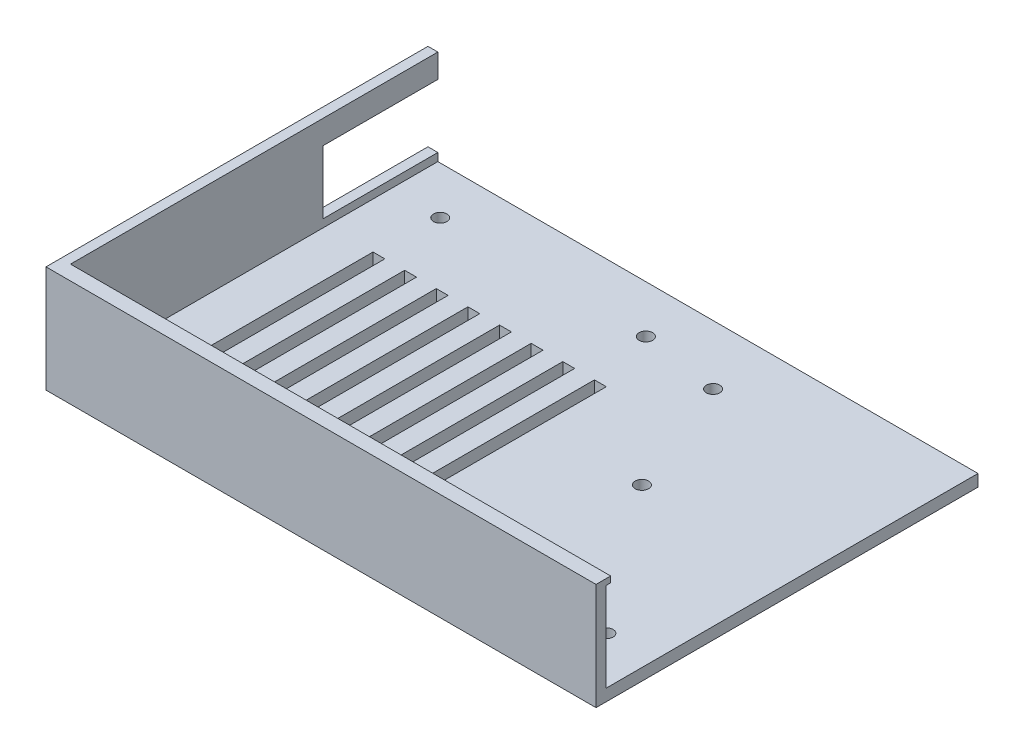
from build123d import *

# Parameters (mm, degrees)
SKETCH1_W                     = 278.2
SKETCH1_H                     = 193.2
SHELL_BLOCK_DEPTH             = 27
SKETCH2_W                     = 273.2
SKETCH2_H                     = 185.8
FRONT_OPENING_DEPTH           = 1.5
SKETCH3_W                     = 273.2
SKETCH3_H                     = 188.2
DISPLAY_POCKET_DEPTH          = 22.5
SKETCH4_W                     = 3
SKETCH4_H                     = 56
VENT_SLOTS_DEPTH              = 4
SKETCH5_W                     = 58
SKETCH5_H                     = 16
CABLE_EXIT_X_SHORT_SIDE_DEPTH = 140.1
SKETCH6_R                     = 1.7
BOLT_HOLES_DEPTH              = 4
KEEP_ONE_HALF_X_DEPTH         = 172.491603293
KEEP_ONE_HALF_X_DEPTH_BACK    = 172.491603293
SKETCH7_W                     = 200
SKETCH7_H                     = 400
KEEP_ONE_QUARTER_Z_DEPTH      = 172.491603293
KEEP_ONE_QUARTER_Z_DEPTH_BACK = 172.491603293
SKETCH8_W                     = 400
SKETCH8_H                     = 200


with BuildPart() as part:
    # Sketch1 → Shell Block (new body)
    with BuildSketch(Plane(origin=(0, 0, 0), x_dir=(1, 0, 0), z_dir=(0, 1, 0))):
        Rectangle(SKETCH1_W, SKETCH1_H)
    extrude(amount=SHELL_BLOCK_DEPTH)

    # Sketch2 → Front Opening (cut)
    with BuildSketch(Plane(origin=(0, 27, 0), x_dir=(1, 0, 0), z_dir=(0, 1, 0))):
        Rectangle(SKETCH2_W, SKETCH2_H)
    extrude(amount=-FRONT_OPENING_DEPTH, mode=Mode.SUBTRACT)

    # Sketch3 → Display Pocket (cut)
    with BuildSketch(Plane(origin=(0, 25.5, 0), x_dir=(1, 0, 0), z_dir=(0, 1, 0))):
        Rectangle(SKETCH3_W, SKETCH3_H)
    extrude(amount=-DISPLAY_POCKET_DEPTH, mode=Mode.SUBTRACT)

    # Sketch4 → Vent Slots (cut)
    with BuildSketch(Plane(origin=(0, 3, 0), x_dir=(1, 0, 0), z_dir=(0, 1, 0))):
        with Locations((-67.5, 56)):
            Rectangle(SKETCH4_W, SKETCH4_H)
        with Locations((-67.5, -56)):
            Rectangle(SKETCH4_W, SKETCH4_H)
        with Locations((-75.5, 56)):
            Rectangle(SKETCH4_W, SKETCH4_H)
        with Locations((-75.5, -56)):
            Rectangle(SKETCH4_W, SKETCH4_H)
        with Locations((-83.5, 56)):
            Rectangle(SKETCH4_W, SKETCH4_H)
        with Locations((-83.5, -56)):
            Rectangle(SKETCH4_W, SKETCH4_H)
        with Locations((-91.5, 56)):
            Rectangle(SKETCH4_W, SKETCH4_H)
        with Locations((-91.5, -56)):
            Rectangle(SKETCH4_W, SKETCH4_H)
        with Locations((-99.5, 56)):
            Rectangle(SKETCH4_W, SKETCH4_H)
        with Locations((-99.5, -56)):
            Rectangle(SKETCH4_W, SKETCH4_H)
        with Locations((-107.5, 56)):
            Rectangle(SKETCH4_W, SKETCH4_H)
        with Locations((-107.5, -56)):
            Rectangle(SKETCH4_W, SKETCH4_H)
        with Locations((-115.5, 56)):
            Rectangle(SKETCH4_W, SKETCH4_H)
        with Locations((-115.5, -56)):
            Rectangle(SKETCH4_W, SKETCH4_H)
        with Locations((-123.5, 56)):
            Rectangle(SKETCH4_W, SKETCH4_H)
        with Locations((-123.5, -56)):
            Rectangle(SKETCH4_W, SKETCH4_H)
    extrude(amount=-VENT_SLOTS_DEPTH, mode=Mode.SUBTRACT)

    # Sketch5 → Cable Exit (-X short side) (cut)
    with BuildSketch(Plane(origin=(0, 0, 0), x_dir=(0, 0, -1), z_dir=(1, 0, 0))):
        with Locations((0, 13)):
            Rectangle(SKETCH5_W, SKETCH5_H)
    extrude(amount=-CABLE_EXIT_X_SHORT_SIDE_DEPTH, mode=Mode.SUBTRACT)

    # Sketch6 → Bolt Holes (cut)
    with BuildSketch(Plane(origin=(0, 3, 0), x_dir=(1, 0, 0), z_dir=(0, 1, 0))):
        with Locations((-40, -45)):
            Circle(SKETCH6_R)
        with Locations((-40, 45)):
            Circle(SKETCH6_R)
        with Locations((40, -45)):
            Circle(SKETCH6_R)
        with Locations((40, 45)):
            Circle(SKETCH6_R)
        with Locations((-52, -15)):
            Circle(SKETCH6_R)
        with Locations((-52, 15)):
            Circle(SKETCH6_R)
        with Locations((52, -15)):
            Circle(SKETCH6_R)
        with Locations((52, 15)):
            Circle(SKETCH6_R)
        with Locations((-12, -82)):
            Circle(SKETCH6_R)
        with Locations((-12, 82)):
            Circle(SKETCH6_R)
        with Locations((12, -82)):
            Circle(SKETCH6_R)
        with Locations((12, 82)):
            Circle(SKETCH6_R)
        with Locations((-124, -12)):
            Circle(SKETCH6_R)
        with Locations((-124, 12)):
            Circle(SKETCH6_R)
        with Locations((124, -12)):
            Circle(SKETCH6_R)
        with Locations((124, 12)):
            Circle(SKETCH6_R)
        with Locations((-72, 12)):
            Circle(SKETCH6_R)
        with Locations((-72, -12)):
            Circle(SKETCH6_R)
    extrude(amount=-BOLT_HOLES_DEPTH, mode=Mode.SUBTRACT)

    # Sketch7 → Keep one half (X) (cut, two sides: drawn at the far end of the back side and taken through both)
    with BuildSketch(Plane(origin=(0, 0, 0), x_dir=(1, 0, 0), z_dir=(0, 1, 0)).offset(-KEEP_ONE_HALF_X_DEPTH_BACK)):
        with Locations((100, 0)):
            Rectangle(SKETCH7_W, SKETCH7_H)
    extrude(amount=KEEP_ONE_HALF_X_DEPTH + KEEP_ONE_HALF_X_DEPTH_BACK, mode=Mode.SUBTRACT)

    # Sketch8 → Keep one quarter (Z) (cut, two sides: drawn at the far end of the back side and taken through both)
    with BuildSketch(Plane(origin=(0, 0, 0), x_dir=(1, 0, 0), z_dir=(0, 1, 0)).offset(-KEEP_ONE_QUARTER_Z_DEPTH_BACK)):
        with Locations((0, 100)):
            Rectangle(SKETCH8_W, SKETCH8_H)
    extrude(amount=KEEP_ONE_QUARTER_Z_DEPTH + KEEP_ONE_QUARTER_Z_DEPTH_BACK, mode=Mode.SUBTRACT)


solid = part.part
